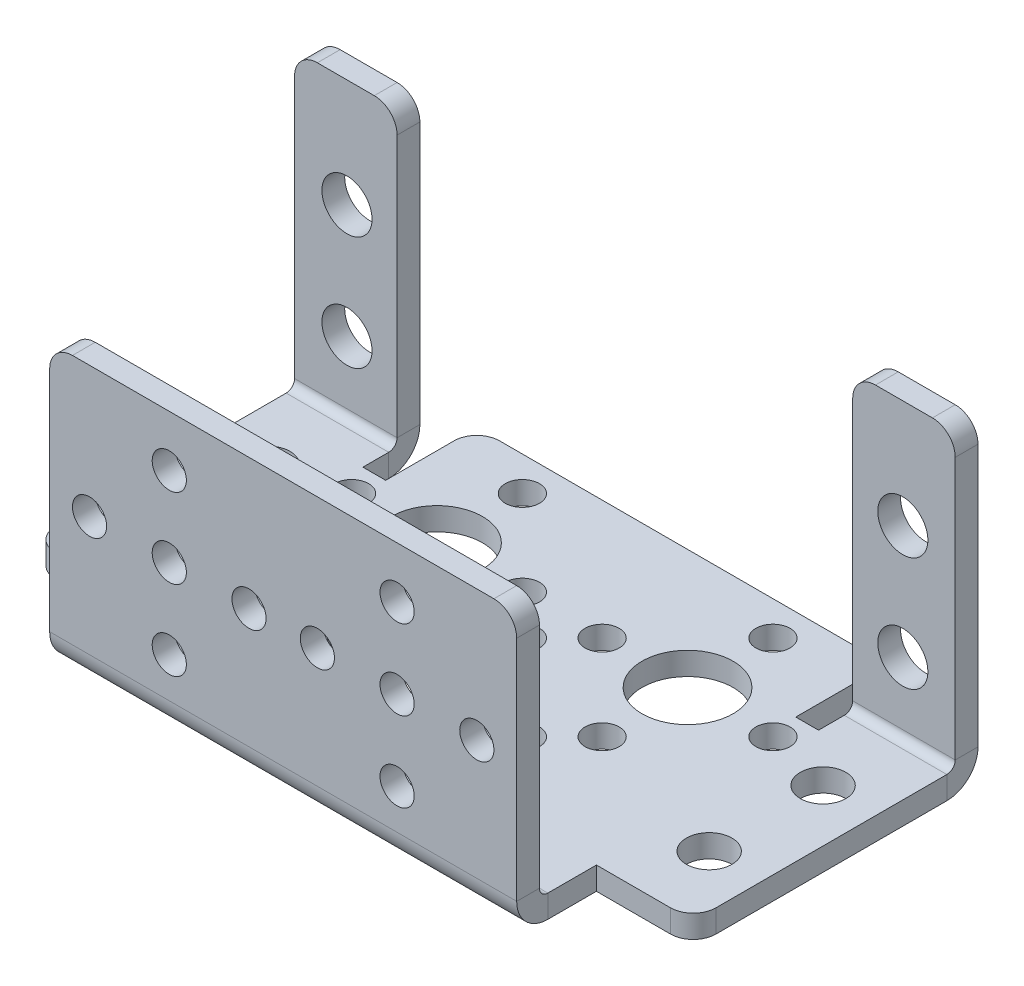
from build123d import *

# Parameters (mm, degrees)
SKETCH1_R                    = 1.5
SKETCH1_R_2                  = 2.2
SKETCH1_R_3                  = 2
SKETCH1_R_4                  = 4
BASE_FLANGE1_DEPTH           = 2
SKETCHED_START               = -20.5
SKETCHED_BEND1_DEPTH         = 41
SKETCHED_START_2             = -29
SKETCHED_BEND1_2_DEPTH       = 9
SKETCHED_START_3             = 20
SKETCHED_BEND1_3_DEPTH       = 9
SKETCHED_BEND1_4_DEPTH       = 41
SKETCHED_BEND1_5_DEPTH       = 9
SKETCHED_BEND1_6_DEPTH       = 9
SKETCHED_START_4             = -25
SKETCHED_BEND1_7_OUTLINE_R   = 1.5
SKETCHED_BEND1_7_OUTLINE_R_2 = 2.2
SKETCHED_BEND1_7_DEPTH       = 32
SKETCHED_START_5             = 5
SKETCHED_BEND1_8_DEPTH       = 2


with BuildPart() as part:
    # Base-Flange1: sheet metal written as solids
    # Sketch1 → Base-Flange1 (new body)
    with BuildSketch(Plane(origin=(0, 0, 0), x_dir=(1, 0, 0), z_dir=(0, 1, 0))):
        with BuildLine():
            Line((-27, 0), (-20.5, 0))
            Line((-20.5, 0), (-20.5, -27))
            ThreePointArc((-20.5, -27), (-19.914213562, -28.414213562), (-18.5, -29))
            Line((-18.5, -29), (18.5, -29))
            ThreePointArc((18.5, -29), (19.914213562, -28.414213562), (20.5, -27))
            Line((20.5, -27), (20.5, 0))
            Line((20.5, 0), (27, 0))
            ThreePointArc((27, 0), (28.414213562, 0.585786438), (29, 2))
            Line((29, 2), (29, 48))
            ThreePointArc((29, 48), (28.414213562, 49.414213562), (27, 50))
            Line((27, 50), (22, 50))
            ThreePointArc((22, 50), (20.585786438, 49.414213562), (20, 48))
            Line((20, 48), (20, 20))
            Line((20, 20), (18, 20))
            Line((18, 20), (18, 26))
            ThreePointArc((18, 26), (17.414213562, 27.414213562), (16, 28))
            Line((16, 28), (-16, 28))
            ThreePointArc((-16, 28), (-17.414213562, 27.414213562), (-18, 26))
            Line((-18, 26), (-18, 20))
            Line((-18, 20), (-20, 20))
            Line((-20, 20), (-20, 48))
            ThreePointArc((-20, 48), (-20.585786438, 49.414213562), (-22, 50))
            Line((-22, 50), (-27, 50))
            ThreePointArc((-27, 50), (-28.414213562, 49.414213562), (-29, 48))
            Line((-29, 48), (-29, 2))
            ThreePointArc((-29, 2), (-28.414213562, 0.585786438), (-27, 0))
        make_face()
        with Locations(Location((-17, -17.5, 0), (0, 0, 270))):
            Circle(SKETCH1_R, mode=Mode.SUBTRACT)
        with Locations(Location((-10, -17.5, 0), (0, 0, 270))):
            Circle(SKETCH1_R, mode=Mode.SUBTRACT)
        with Locations(Location((-10, -10.5, 0), (0, 0, 270))):
            Circle(SKETCH1_R, mode=Mode.SUBTRACT)
        with Locations(Location((-3, -17.5, 0), (0, 0, 270))):
            Circle(SKETCH1_R, mode=Mode.SUBTRACT)
        with Locations(Location((-10, -24.5, 0), (0, 0, 270))):
            Circle(SKETCH1_R, mode=Mode.SUBTRACT)
        with Locations(Location((24.4, 40.5, 0), (0, 0, 270))):
            Circle(SKETCH1_R_2, mode=Mode.SUBTRACT)
        with Locations(Location((24.4, 30.5, 0), (0, 0, 270))):
            Circle(SKETCH1_R_2, mode=Mode.SUBTRACT)
        with Locations(Location((-24.4, 30.5, 0), (0, 0, 90))):
            Circle(SKETCH1_R_2, mode=Mode.SUBTRACT)
        with Locations(Location((-24.4, 40.5, 0), (0, 0, 90))):
            Circle(SKETCH1_R_2, mode=Mode.SUBTRACT)
        with Locations(Location((24.4, 6, 0), (0, 0, 270))):
            Circle(SKETCH1_R_3, mode=Mode.SUBTRACT)
        with Locations(Location((24.4, 16, 0), (0, 0, 270))):
            Circle(SKETCH1_R_3, mode=Mode.SUBTRACT)
        with Locations(Location((-24.4, 16, 0), (0, 0, 90))):
            Circle(SKETCH1_R_3, mode=Mode.SUBTRACT)
        with Locations(Location((-24.4, 6, 0), (0, 0, 90))):
            Circle(SKETCH1_R_3, mode=Mode.SUBTRACT)
        with Locations(Location((0, -1, 0), (0, 0, 270))):
            Circle(SKETCH1_R, mode=Mode.SUBTRACT)
        with Locations(Location((0, 6.5, 0), (0, 0, 270))):
            Circle(SKETCH1_R_4, mode=Mode.SUBTRACT)
        with Locations(Location((-7.5, 6.5, 0), (0, 0, 270))):
            Circle(SKETCH1_R, mode=Mode.SUBTRACT)
        with Locations(Location((0, 14, 0), (0, 0, 270))):
            Circle(SKETCH1_R, mode=Mode.SUBTRACT)
        with Locations(Location((7.5, 6.5, 0), (0, 0, 270))):
            Circle(SKETCH1_R, mode=Mode.SUBTRACT)
        with Locations(Location((-3.5, 17.5, 0), (0, 0, 270))):
            Circle(SKETCH1_R, mode=Mode.SUBTRACT)
        with Locations(Location((-11, 17.5, 0), (0, 0, 270))):
            Circle(SKETCH1_R_4, mode=Mode.SUBTRACT)
        with Locations(Location((-11, 25, 0), (0, 0, 270))):
            Circle(SKETCH1_R, mode=Mode.SUBTRACT)
        with Locations(Location((-18.5, 17.5, 0), (0, 0, 270))):
            Circle(SKETCH1_R, mode=Mode.SUBTRACT)
        with Locations(Location((-11, 10, 0), (0, 0, 270))):
            Circle(SKETCH1_R, mode=Mode.SUBTRACT)
        with Locations(Location((3.5, 17.5, 0), (0, 0, 270))):
            Circle(SKETCH1_R, mode=Mode.SUBTRACT)
        with Locations(Location((11, 17.5, 0), (0, 0, 270))):
            Circle(SKETCH1_R_4, mode=Mode.SUBTRACT)
        with Locations(Location((11, 10, 0), (0, 0, 270))):
            Circle(SKETCH1_R, mode=Mode.SUBTRACT)
        with Locations(Location((18.5, 17.5, 0), (0, 0, 270))):
            Circle(SKETCH1_R, mode=Mode.SUBTRACT)
        with Locations(Location((11, 25, 0), (0, 0, 270))):
            Circle(SKETCH1_R, mode=Mode.SUBTRACT)
        with Locations(Location((10, -10.5, 0), (0, 0, 90))):
            Circle(SKETCH1_R, mode=Mode.SUBTRACT)
        with Locations(Location((10, -24.5, 0), (0, 0, 90))):
            Circle(SKETCH1_R, mode=Mode.SUBTRACT)
        with Locations(Location((3, -17.5, 0), (0, 0, 90))):
            Circle(SKETCH1_R, mode=Mode.SUBTRACT)
        with Locations(Location((10, -17.5, 0), (0, 0, 90))):
            Circle(SKETCH1_R, mode=Mode.SUBTRACT)
        with Locations(Location((17, -17.5, 0), (0, 0, 90))):
            Circle(SKETCH1_R, mode=Mode.SUBTRACT)
    extrude(amount=-BASE_FLANGE1_DEPTH)

    # Sketched Bend1: read off the stored shape, not the designer's step
    # Sketched Bend1 outline → Sketched Bend1 (cut)
    with BuildSketch(Plane.YZ.offset(SKETCHED_START)):
        with BuildLine():
            Line((-2, 29), (-2, 4.2634))
            ThreePointArc((-2, 4.2634), (-1.443395312, 5.917667209), (0, 6.899002398))
            Line((0, 6.899002398), (0, 29))
            Line((0, 29), (-2, 29))
        make_face()
    extrude(amount=SKETCHED_BEND1_DEPTH, mode=Mode.SUBTRACT)

    # Sketched Bend1 2 outline → Sketched Bend1 2 (cut)
    with BuildSketch(Plane.YZ.offset(SKETCHED_START_2)):
        with BuildLine():
            ThreePointArc((0, -24.899002398), (-1.443395312, -23.917667209), (-2, -22.2634))
            Line((-2, -22.2634), (-2, -50))
            Line((-2, -50), (0, -50))
            Line((0, -50), (0, -24.899002398))
        make_face()
    extrude(amount=SKETCHED_BEND1_2_DEPTH, mode=Mode.SUBTRACT)

    # Sketched Bend1 3 outline → Sketched Bend1 3 (cut)
    with BuildSketch(Plane.YZ.offset(SKETCHED_START_3)):
        with BuildLine():
            ThreePointArc((0, -24.899002398), (-1.443395312, -23.917667209), (-2, -22.2634))
            Line((-2, -22.2634), (-2, -50))
            Line((-2, -50), (0, -50))
            Line((0, -50), (0, -24.899002398))
        make_face()
    extrude(amount=SKETCHED_BEND1_3_DEPTH, mode=Mode.SUBTRACT)

    # Sketched Bend1 4 outline → Sketched Bend1 4 (add)
    with BuildSketch(Plane.YZ.offset(SKETCHED_START)):
        with BuildLine():
            ThreePointArc((0.7366, 7), (0.364854094, 6.974633029), (0, 6.899002398))
            Line((0, 6.899002398), (0, 4.2634))
            ThreePointArc((0, 4.2634), (0.215745145, 4.784254855), (0.7366, 5))
            Line((0.7366, 5), (22.745355099, 5))
            Line((22.745355099, 5), (22.745355099, 7))
            Line((22.745355099, 7), (0.7366, 7))
        make_face()
    extrude(amount=SKETCHED_BEND1_4_DEPTH)

    # Sketched Bend1 5 outline → Sketched Bend1 5 (add)
    with BuildSketch(Plane.YZ.offset(SKETCHED_START_2)):
        with BuildLine():
            Line((0, -22.2634), (0, -24.899002398))
            ThreePointArc((0, -24.899002398), (0.364854094, -24.974633029), (0.7366, -25))
            Line((0.7366, -25), (25.745355099, -25))
            Line((25.745355099, -25), (25.745355099, -23))
            Line((25.745355099, -23), (0.7366, -23))
            ThreePointArc((0.7366, -23), (0.215745145, -22.784254855), (0, -22.2634))
        make_face()
    extrude(amount=SKETCHED_BEND1_5_DEPTH)

    # Sketched Bend1 6 outline → Sketched Bend1 6 (add)
    with BuildSketch(Plane.YZ.offset(SKETCHED_START_3)):
        with BuildLine():
            Line((0, -22.2634), (0, -24.899002398))
            ThreePointArc((0, -24.899002398), (0.364854094, -24.974633029), (0.7366, -25))
            Line((0.7366, -25), (25.745355099, -25))
            Line((25.745355099, -25), (25.745355099, -23))
            Line((25.745355099, -23), (0.7366, -23))
            ThreePointArc((0.7366, -23), (0.215745145, -22.784254855), (0, -22.2634))
        make_face()
    extrude(amount=SKETCHED_BEND1_6_DEPTH)

    # Sketched Bend1 7 outline → Sketched Bend1 7 (cut)
    with BuildSketch(Plane.XY.offset(SKETCHED_START_4)):
        with BuildLine():
            ThreePointArc((-29, 23.745355099), (-28.414213562, 25.159568661), (-27, 25.745355099))
            Line((-27, 25.745355099), (-29, 25.745355099))
            Line((-29, 25.745355099), (-29, 23.745355099))
        make_face()
        with BuildLine():
            ThreePointArc((-22, 25.745355099), (-20.585786438, 25.159568661), (-20, 23.745355099))
            Line((-20, 23.745355099), (-20, 25.745355099))
            Line((-20, 25.745355099), (-22, 25.745355099))
        make_face()
        with BuildLine():
            Line((29, 25.745355099), (27, 25.745355099))
            ThreePointArc((27, 25.745355099), (28.414213562, 25.159568661), (29, 23.745355099))
            Line((29, 23.745355099), (29, 25.745355099))
        make_face()
        with BuildLine():
            Line((20, 25.745355099), (20, 23.745355099))
            ThreePointArc((20, 23.745355099), (20.585786438, 25.159568661), (22, 25.745355099))
            Line((22, 25.745355099), (20, 25.745355099))
        make_face()
        with BuildLine():
            Line((20, 22.745355099), (18.5, 22.745355099))
            ThreePointArc((18.5, 22.745355099), (19.322875656, 22.568230754), (20, 22.068230754))
            Line((20, 22.068230754), (20, 22.745355099))
        make_face()
        with BuildLine():
            Line((-20, 22.745355099), (-20, 22.068230754))
            ThreePointArc((-20, 22.068230754), (-19.322875656, 22.568230754), (-18.5, 22.745355099))
            Line((-18.5, 22.745355099), (-20, 22.745355099))
        make_face()
        with Locations((17, 11.245355099)):
            Circle(SKETCHED_BEND1_7_OUTLINE_R)
        with Locations((-10, 18.245355099)):
            Circle(SKETCHED_BEND1_7_OUTLINE_R)
        with Locations((-3, 11.245355099)):
            Circle(SKETCHED_BEND1_7_OUTLINE_R)
        with Locations((-10, 4.245355099)):
            Circle(SKETCHED_BEND1_7_OUTLINE_R)
        with Locations((-17, 11.245355099)):
            Circle(SKETCHED_BEND1_7_OUTLINE_R)
        with Locations((10, 11.245355099)):
            Circle(SKETCHED_BEND1_7_OUTLINE_R)
        with Locations((3, 11.245355099)):
            Circle(SKETCHED_BEND1_7_OUTLINE_R)
        with Locations((10, 18.245355099)):
            Circle(SKETCHED_BEND1_7_OUTLINE_R)
        with Locations((-10, 11.245355099)):
            Circle(SKETCHED_BEND1_7_OUTLINE_R)
        with Locations((10, 4.245355099)):
            Circle(SKETCHED_BEND1_7_OUTLINE_R)
        with Locations((24.4, 16.245355099)):
            Circle(SKETCHED_BEND1_7_OUTLINE_R_2)
        with Locations((24.4, 6.245355099)):
            Circle(SKETCHED_BEND1_7_OUTLINE_R_2)
        with Locations((-24.4, 6.245355099)):
            Circle(SKETCHED_BEND1_7_OUTLINE_R_2)
        with Locations((-24.4, 16.245355099)):
            Circle(SKETCHED_BEND1_7_OUTLINE_R_2)
    extrude(amount=SKETCHED_BEND1_7_DEPTH, mode=Mode.SUBTRACT)

    # Sketched Bend1 8 outline → Sketched Bend1 8 (cut)
    with BuildSketch(Plane.XY.offset(SKETCHED_START_5)):
        with BuildLine():
            Line((-20.5, 22.745355099), (-20.5, 20.745355099))
            ThreePointArc((-20.5, 20.745355099), (-20.370828693, 21.45246188), (-20, 22.068230754))
            Line((-20, 22.068230754), (-20, 22.745355099))
            Line((-20, 22.745355099), (-20.5, 22.745355099))
        make_face()
        with BuildLine():
            Line((20, 22.745355099), (20, 22.068230754))
            ThreePointArc((20, 22.068230754), (20.370828693, 21.45246188), (20.5, 20.745355099))
            Line((20.5, 20.745355099), (20.5, 22.745355099))
            Line((20.5, 22.745355099), (20, 22.745355099))
        make_face()
    extrude(amount=SKETCHED_BEND1_8_DEPTH, mode=Mode.SUBTRACT)


solid = part.part
